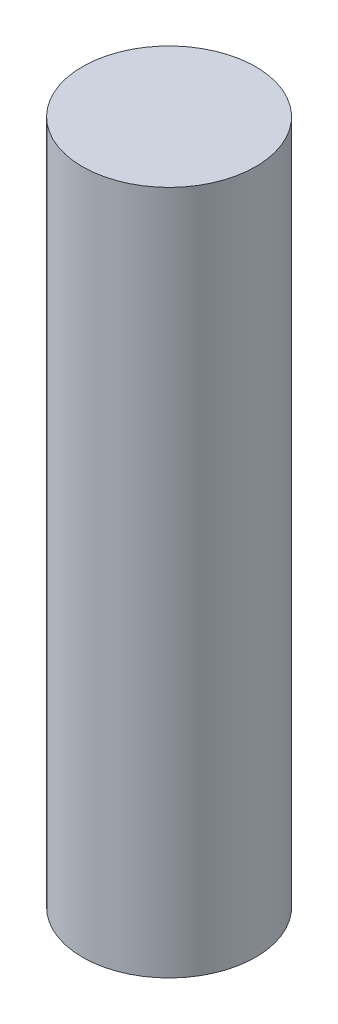
from build123d import *

# Parameters (mm, degrees)
SKETCH1_R           = 9
BOSS_EXTRUDE1_DEPTH = 71.12


with BuildPart() as part:
    # Sketch1 → Boss-Extrude1 (new body)
    with BuildSketch(Plane(origin=(0, 0, 0), x_dir=(1, 0, 0), z_dir=(0, 1, 0))):
        Circle(SKETCH1_R)
    extrude(amount=BOSS_EXTRUDE1_DEPTH)


solid = part.part
